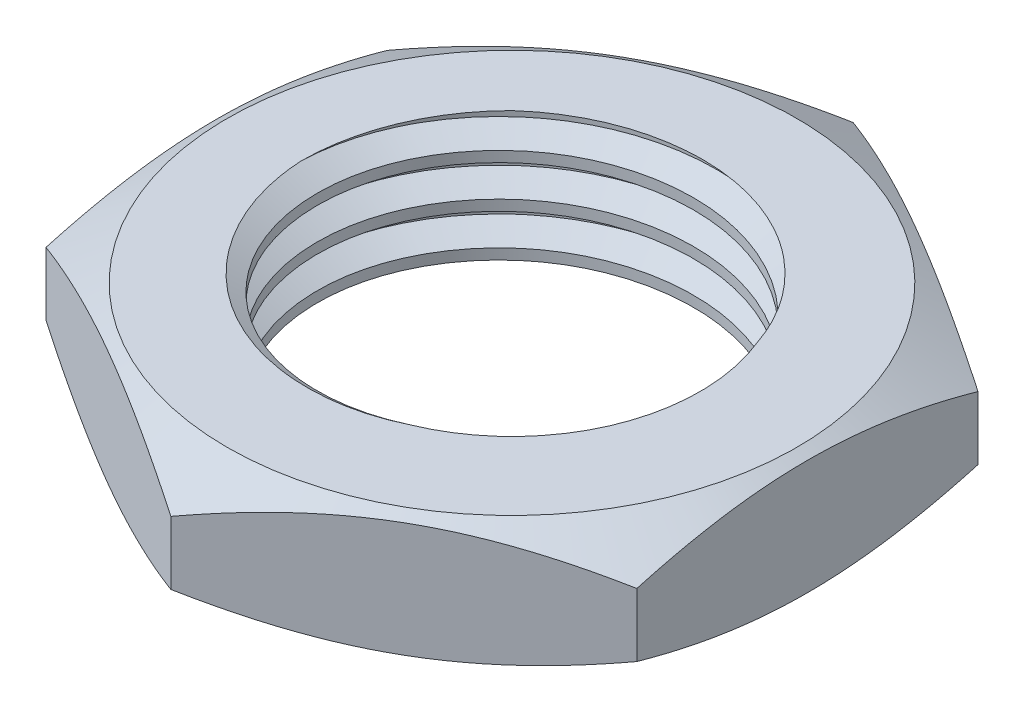
from build123d import *

# Parameters (mm, degrees)
SKETCH1_R           = 5
BOSS_EXTRUDE1_DEPTH = 3
THREAD1_PITCH       = 1
THREAD1_FROM        = 1
THREAD1_TO          = 4


with BuildPart() as part:
    # Sketch1 → Boss-Extrude1 (new body)
    with BuildSketch(Plane(origin=(0, 0, 0), x_dir=(1, 0, 0), z_dir=(0, 1, 0))):
        Polygon((0, 8.082903769), (-7, 4.041451884), (-7, -4.041451884), (0, -8.082903769), (7, -4.041451884), (7, 4.041451884), align=None)
        with Locations(Location((0, 0, 0), (0, 0, 270))):
            Circle(SKETCH1_R, mode=Mode.SUBTRACT)
    extrude(amount=BOSS_EXTRUDE1_DEPTH)

    # Sketch2 → Cut-Revolve1 (revolve, cut)
    with BuildSketch(Plane(origin=(0, 0, 0), x_dir=(0, 0, -1), z_dir=(1, 0, 0))):
        Polygon((-8.082903769, 3), (-6.75, 3), (-8.082903769, 2.25), align=None)
        Polygon((-8.082903769, 0), (-8.082903769, 0.75), (-6.75, 0), align=None)
    revolve(axis=Axis((0, 0, 0), (0, -1, 0)), mode=Mode.SUBTRACT)

    # Thread1: arcs per turn and ends read off the stored shape
    # Thread1: the profile of Thread Profile1 profile screwed along a right-hand helix through 4 turns, 8 arcs to a turn; built about Z, then put on its axis
    thread1_z = Axis((0, 0, 0), (0, 0, 1))
    thread1_corners = [(5.0003, 0, -0.000173205), (5.0003, 0, 0.875173202), (4.458734125, 0, 0.562499999), (4.458734125, 0, 0.312499999)]
    with BuildLine(mode=Mode.PRIVATE) as thread1_profile:
        Line(thread1_corners[0], thread1_corners[1])
        Line(thread1_corners[1], thread1_corners[2])
        Line(thread1_corners[2], thread1_corners[3])
        Line(thread1_corners[3], thread1_corners[0])
    thread1_cap = Face(thread1_profile.wire())
    thread1_turn_angles = [0, 22.5, 45, 67.5, 90, 112.5, 135, 157.5, 180, 202.5, 225, 247.5, 270, 292.5, 315, 337.5, 360]
    thread1_turn_weights = [1, 0.9238795325112867, 1, 0.9238795325112867, 1, 0.9238795325112867, 1, 0.9238795325112867, 1, 0.9238795325112867, 1, 0.9238795325112867, 1, 0.9238795325112867, 1, 0.9238795325112867, 1]
    thread1_turn_rails = [Edge.make_bspline([Vector(p[0], p[1], 0).rotate(thread1_z, thread1_turn_angles[k]) / thread1_turn_weights[k] + Vector(0, 0, p[2] + THREAD1_PITCH * thread1_turn_angles[k] / 360) for k in range(17)], [0, 0, 0, 1, 1, 2, 2, 3, 3, 4, 4, 5, 5, 6, 6, 7, 7, 8, 8, 8], 2, thread1_turn_weights) for p in thread1_corners]
    thread1_turn_sides = [Face.make_surface_from_curves(thread1_turn_rails[p[0]], thread1_turn_rails[p[1]]) for p in [(0, 1), (1, 2), (2, 3), (3, 0)]]
    thread1 = Plane(origin=(0, 4, 0), x_dir=(-1, 0, 0), z_dir=(0, -1, 0)) * split(split(Solid(Shell([*[p.moved(Location((0, 0, THREAD1_PITCH * i))) for i in range(4) for p in thread1_turn_sides], thread1_cap, thread1_cap.rotate(thread1_z, 1440).moved(Location((0, 0, THREAD1_PITCH * 1440 / 360)))])), bisect_by=Plane.XY.offset(THREAD1_FROM), keep=Keep.TOP, mode=Mode.PRIVATE), bisect_by=Plane.XY.offset(THREAD1_TO), keep=Keep.BOTTOM, mode=Mode.PRIVATE)
    add(thread1)


solid = part.part
